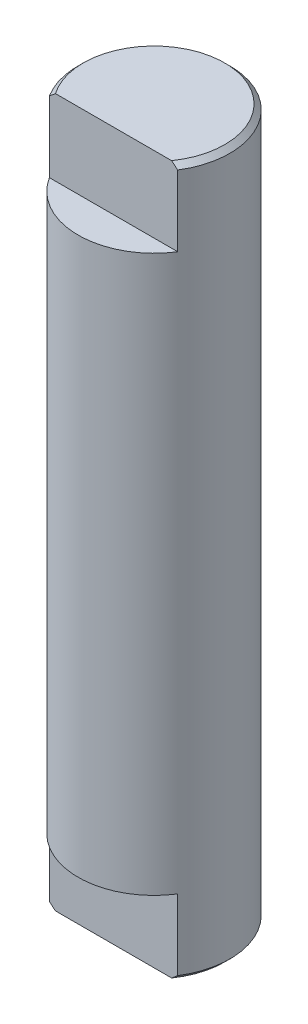
from build123d import *

# Parameters (mm, degrees)
ESQUISSE1_W             = 1.5
ESQUISSE1_H             = 14
ENL_V_START             = -1.5
ENL_V_MAT_EXTRU_1_DEPTH = 1.5
ENL_V_MAT_EXTRU_2_DEPTH = 1.5
CHANFREIN1_SIZE         = 0.1
CHANFREIN2_SIZE         = 0.1


with BuildPart() as part:
    # Esquisse1 → Révolution1 (revolve)
    with BuildSketch(Plane(origin=(0, 0, 10.4), x_dir=(-1, 0, 0), z_dir=(0, 0, -1))):
        with Locations((-1.607807721, -5.637142552)):
            Rectangle(ESQUISSE1_W, ESQUISSE1_H)
    revolve(axis=Axis((0.857807721, -12.637142552, 10.4), (0, 1, 0)))

    # Esquisse2 → Enlèv. mat.-Extru.1 (cut)
    with BuildSketch(Plane(origin=(0, 1.362857448, 0), x_dir=(-1, 0, 0), z_dir=(0, 1, 0)).offset(ENL_V_START)):
        with BuildLine():
            Line((-2.12666531, 11.2), (0.411050198, 11.2))
            ThreePointArc((0.411050198, 11.2), (-0.857807556, 11.9), (-2.12666531, 11.2))
        make_face()
    extrude(amount=ENL_V_MAT_EXTRU_1_DEPTH, mode=Mode.SUBTRACT)

    # Esquisse3 → Enlèv. mat.-Extru.2 (cut)
    with BuildSketch(Plane.XZ.offset(12.637142552)):
        with BuildLine():
            Line((-0.41105011, 11.2), (2.126665398, 11.2))
            ThreePointArc((2.126665398, 11.2), (0.857807644, 11.9), (-0.41105011, 11.2))
        make_face()
    extrude(amount=-ENL_V_MAT_EXTRU_2_DEPTH, mode=Mode.SUBTRACT)

    # Chanfrein1
    chanfrein1_edges = [part.edges().sort_by_distance(p)[0] for p in [
        (0.44144652, 1.362857448, 8.958943668),
    ]]
    chamfer(chanfrein1_edges, length=CHANFREIN1_SIZE)

    # Chanfrein2
    chanfrein2_edges = [part.edges().sort_by_distance(p)[0] for p in [
        (0.441446497, -12.637142552, 8.958943675),
    ]]
    chamfer(chanfrein2_edges, length=CHANFREIN2_SIZE)


solid = part.part
